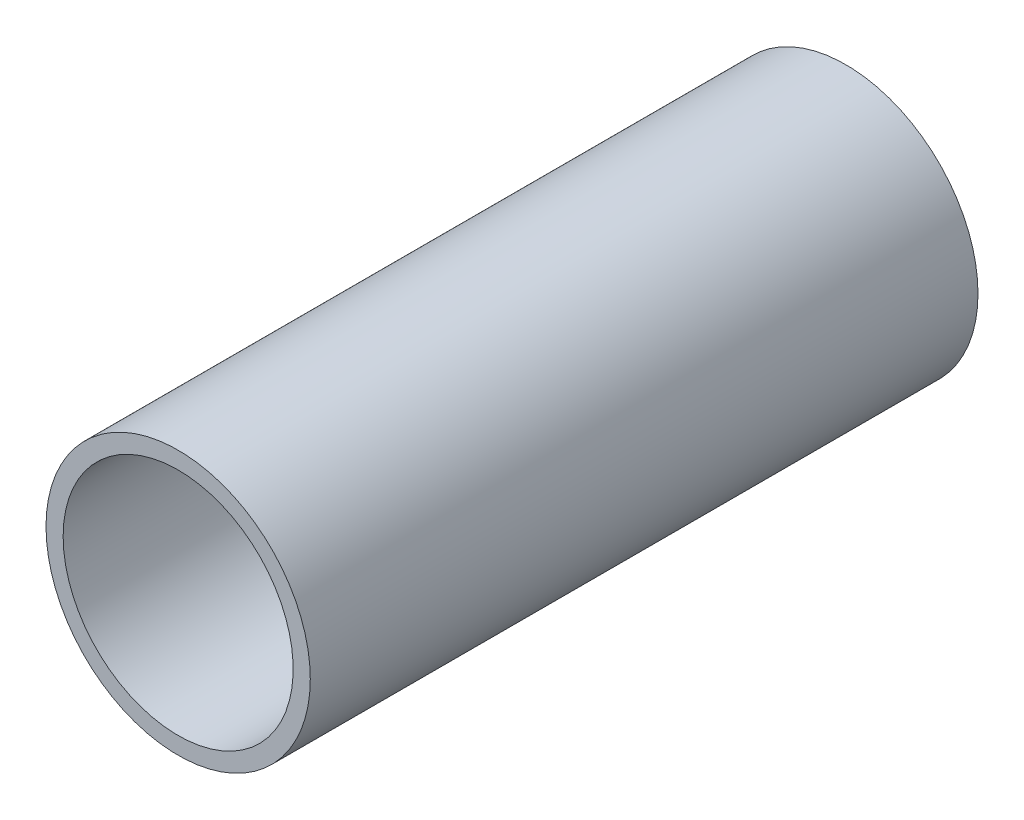
from build123d import *

# Parameters (mm, degrees)
SKETCH1_R           = 30.1625
SKETCH1_R_2         = 26.2509
BOSS_EXTRUDE1_DEPTH = 152.4


with BuildPart() as part:
    # Sketch1 → Boss-Extrude1 (new body)
    with BuildSketch(Plane.XY):
        Circle(SKETCH1_R)
        Circle(SKETCH1_R_2, mode=Mode.SUBTRACT)
    extrude(amount=BOSS_EXTRUDE1_DEPTH)


solid = part.part
